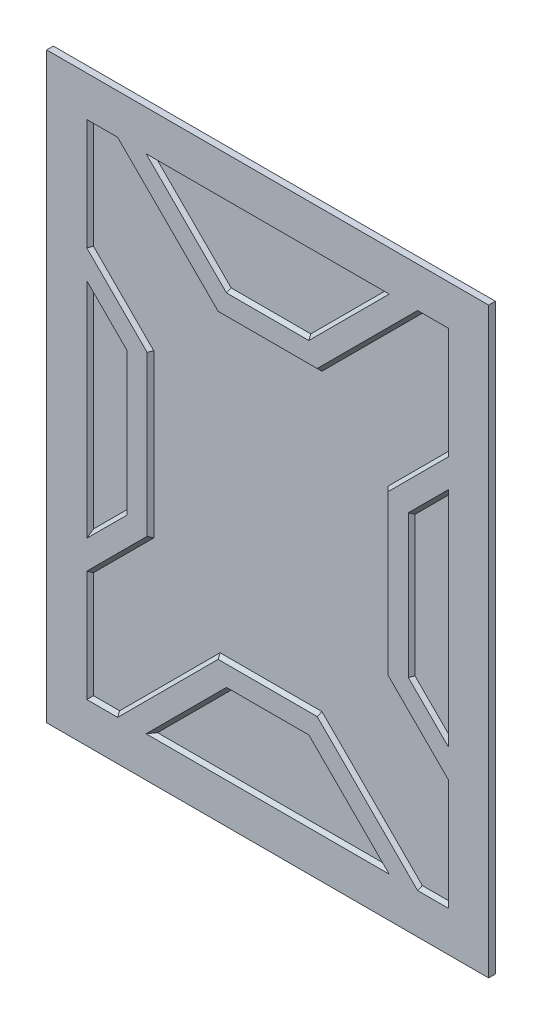
from build123d import *

# Parameters (mm, degrees)
ESQUISSE1_W             = 660
ESQUISSE1_H             = 870
BOSS_EXTRU_1_DEPTH      = 10
ENL_V_MAT_EXTRU_1_DEPTH = 5
CHANFREIN1_SIZE         = 5


with BuildPart() as part:
    # Esquisse1 → Boss.-Extru.1 (new body)
    with BuildSketch(Plane.XY):
        with Locations((330, 435)):
            Rectangle(ESQUISSE1_W, ESQUISSE1_H)
    extrude(amount=BOSS_EXTRU_1_DEPTH)

    # Esquisse2 → Enlèv. mat.-Extru.1 (cut)
    with BuildSketch(Plane.XY.offset(10)):
        Polygon((120, 328.492424049), (120, 541.507575951), (60, 601.507575951), (60, 268.492424049), align=None)
        Polygon((268.492424049, 690), (391.507575951, 690), (511.507575951, 810), (148.492424049, 810), align=None)
        Polygon((60, 810), (60, 643.933982822), (150, 553.933982822), (150, 316.066017178), (60, 226.066017178), (60, 60), (106.066017178, 60), (256.066017178, 210), (403.933982822, 210), (553.933982822, 60), (600, 60), (600, 226.066017178), (510, 316.066017178), (510, 553.933982822), (600, 643.933982822), (600, 810), (553.933982822, 810), (403.933982822, 660), (256.066017178, 660), (106.066017178, 810), align=None)
        Polygon((540, 328.492424049), (540, 541.507575951), (600, 601.507575951), (600, 268.492424049), align=None)
        Polygon((511.507575951, 60), (148.492424049, 60), (268.492424049, 180), (391.507575951, 180), align=None)
    extrude(amount=-ENL_V_MAT_EXTRU_1_DEPTH, mode=Mode.SUBTRACT)

    # Chanfrein1
    chanfrein1_edges = [part.edges().sort_by_distance(p)[0] for p in [
        (330, 60, 5),
        (208.492424049, 120, 5),
        (330, 180, 5),
        (451.507575951, 120, 5),
        (60, 435, 5),
        (90, 571.507575951, 5),
        (120, 435, 5),
        (90, 298.492424049, 5),
        (600, 435, 5),
        (570, 298.492424049, 5),
        (540, 435, 5),
        (570, 571.507575951, 5),
        (181.066017178, 735, 5),
        (330, 660, 5),
        (478.933982822, 735, 5),
        (576.966991411, 810, 5),
        (600, 726.966991411, 5),
        (555, 598.933982822, 5),
        (510, 435, 5),
        (555, 271.066017178, 5),
        (600, 143.033008589, 5),
        (576.966991411, 60, 5),
        (478.933982822, 135, 5),
        (330, 210, 5),
        (181.066017178, 135, 5),
        (83.033008589, 60, 5),
        (60, 143.033008589, 5),
        (105, 271.066017178, 5),
        (150, 435, 5),
        (105, 598.933982822, 5),
        (60, 726.966991411, 5),
        (83.033008589, 810, 5),
        (330, 810, 5),
        (451.507575951, 750, 5),
        (330, 690, 5),
        (208.492424049, 750, 5),
    ]]
    chamfer(chanfrein1_edges, length=CHANFREIN1_SIZE - 0.0001)  # a hair under: the kernel refuses the full size


solid = part.part
